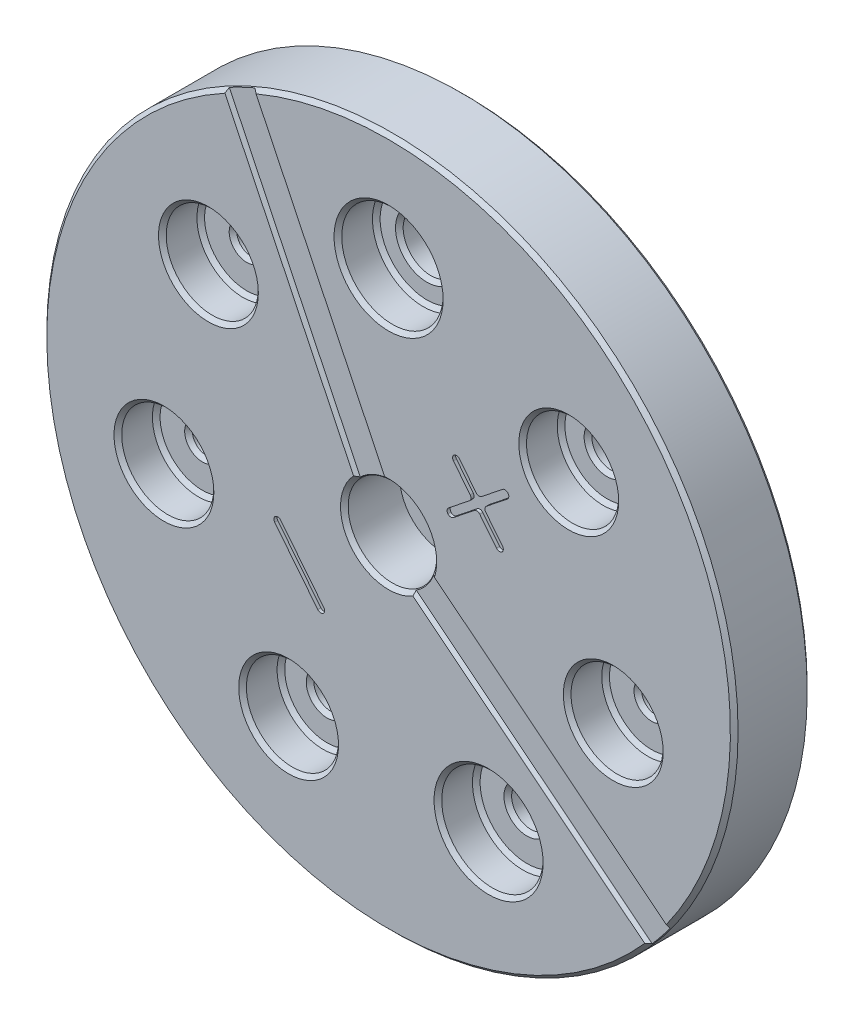
from build123d import *

# Parameters (mm, degrees)
SKETCH1_R               = 28.575
SKETCH1_R_2             = 2.286
SKETCH1_R_3             = 1.5875
SKETCH1_R_4             = 1.143
SKETCH1_R_5             = 1.397
SKETCH1_R_6             = 2.159
BOSS_EXTRUDE1_DEPTH     = 6.35
SKETCH2_R               = 4.191
SKETCH2_R_2             = 3.81
CUT_EXTRUDE1_DEPTH      = 3.175
SKETCH3_R               = 3.6576
CUT_EXTRUDE2_DEPTH      = 4.572
CHAMFER1_SIZE           = 0.3175
CUT_EXTRUDE_THIN2_DEPTH = 0.254
FILLET1_R               = 0.3175
CUT_EXTRUDE_THIN1_DEPTH = 0.254
CHAMFER2_SIZE           = 0.635


# Some blends are built 0.0001 mm under size
with BuildPart() as part:
    # Sketch1 → Boss-Extrude1 (new body)
    with BuildSketch(Plane.XY):
        Circle(SKETCH1_R)
        with Locations((0, 19.05)):
            Circle(SKETCH1_R_2, mode=Mode.SUBTRACT)
        with Locations((14.893889741, 11.877480725)):
            Circle(SKETCH1_R_3, mode=Mode.SUBTRACT)
        with Locations((18.572376727, -4.239023792)):
            Circle(SKETCH1_R_4, mode=Mode.SUBTRACT)
        with Locations((8.26548523, -17.163456934)):
            Circle(SKETCH1_R_3, mode=Mode.SUBTRACT)
        with Locations((-8.26548523, -17.163456934)):
            Circle(SKETCH1_R_5, mode=Mode.SUBTRACT)
        with Locations((-18.572376727, -4.239023792)):
            Circle(SKETCH1_R_4, mode=Mode.SUBTRACT)
        with Locations((-14.893889741, 11.877480725)):
            Circle(SKETCH1_R_4, mode=Mode.SUBTRACT)
        Circle(SKETCH1_R_6, mode=Mode.SUBTRACT)
    extrude(amount=BOSS_EXTRUDE1_DEPTH)

    # Sketch2 → Cut-Extrude1 (cut)
    with BuildSketch(Plane.XY.offset(6.35)):
        with Locations((0, 19.05)):
            Circle(SKETCH2_R)
        with Locations((14.893889741, 11.877480725)):
            Circle(SKETCH2_R_2)
        with Locations((18.572376727, -4.239023792)):
            Circle(SKETCH2_R_2)
        with Locations((8.26548523, -17.163456934)):
            Circle(SKETCH2_R)
        with Locations((-8.26548523, -17.163456934)):
            Circle(SKETCH2_R_2)
        with Locations((-18.572376727, -4.239023792)):
            Circle(SKETCH2_R_2)
        with Locations((-14.893889741, 11.877480725)):
            Circle(SKETCH2_R_2)
    extrude(amount=-CUT_EXTRUDE1_DEPTH, mode=Mode.SUBTRACT)

    # Sketch3 → Cut-Extrude2 (cut)
    with BuildSketch(Plane.XY.offset(6.35)):
        Circle(SKETCH3_R)
    extrude(amount=-CUT_EXTRUDE2_DEPTH, mode=Mode.SUBTRACT)

    # Chamfer1
    chamfer1_edges = [part.edges().sort_by_distance(p)[0] for p in [
        (17.429376727, -4.239023792, 0),
        (6.67798523, -17.163456934, 0),
        (-28.575, 0, 0),
        (-9.66248523, -17.163456934, 0),
        (-19.715376727, -4.239023792, 0),
        (-16.036889741, 11.877480725, 0),
        (-2.159, 0, 0),
        (-28.575, 0, 6.35),
        (11.083889741, 11.877480725, 3.175),
        (13.306389741, 11.877480725, 3.175),
        (11.083889741, 11.877480725, 6.35),
        (13.306389741, 11.877480725, 0),
        (14.762376727, -4.239023792, 3.175),
        (17.429376727, -4.239023792, 3.175),
        (14.762376727, -4.239023792, 6.35),
        (4.07448523, -17.163456934, 3.175),
        (6.67798523, -17.163456934, 3.175),
        (4.07448523, -17.163456934, 6.35),
        (-12.07548523, -17.163456934, 3.175),
        (-9.66248523, -17.163456934, 3.175),
        (-12.07548523, -17.163456934, 6.35),
        (-22.382376727, -4.239023792, 3.175),
        (-19.715376727, -4.239023792, 3.175),
        (-22.382376727, -4.239023792, 6.35),
        (-18.703889741, 11.877480725, 3.175),
        (-16.036889741, 11.877480725, 3.175),
        (-18.703889741, 11.877480725, 6.35),
        (-4.191, 19.05, 3.175),
        (-2.286, 19.05, 3.175),
        (-4.191, 19.05, 6.35),
        (-2.159, 0, 1.778),
        (-3.6576, 0, 6.35),
        (-2.286, 19.05, 0),
    ]]
    chamfer(chamfer1_edges, length=CHAMFER1_SIZE)

    # Sketch5 → Cut-Extrude-Thin2 (cut)
    with BuildSketch(Plane.XY.offset(6.35)):
        Polygon((5.103012367, 3.663418823), (10.06764228, 7.622579065), (9.671726256, 8.119042056), (4.707096343, 4.159881815), align=None)
        Polygon((9.615180928, 3.606873495), (5.656020686, 8.571503409), (5.159557695, 8.175587385), (9.118717937, 3.210957471), align=None)
        Polygon((-9.615180928, -3.606873495), (-5.656020686, -8.571503409), (-5.159557695, -8.175587385), (-9.118717937, -3.210957471), align=None)
    extrude(amount=-CUT_EXTRUDE_THIN2_DEPTH, mode=Mode.SUBTRACT)

    # Fillet1
    fillet1_edges = [part.edges().sort_by_distance(p)[0] for p in [
        (-5.656020686, -8.571503409, 6.223),
        (-9.615180928, -3.606873495, 6.223),
        (-9.118717937, -3.210957471, 6.223),
        (-5.159557695, -8.175587385, 6.223),
        (10.06764228, 7.622579065, 6.223),
        (9.615180928, 3.606873495, 6.223),
        (9.118717937, 3.210957471, 6.223),
        (5.103012367, 3.663418823, 6.223),
        (4.707096343, 4.159881815, 6.223),
        (5.159557695, 8.175587385, 6.223),
        (9.671726256, 8.119042056, 6.223),
        (5.656020686, 8.571503409, 6.223),
        (7.337095828, 5.445040932, 6.223),
        (7.833558819, 5.840956956, 6.223),
        (7.437642795, 6.337419948, 6.223),
        (6.941179804, 5.941503923, 6.223),
    ]]
    fillet(fillet1_edges, radius=FILLET1_R - 0.0001)  # a hair under: the kernel refuses the full size

    # Sketch4 → Cut-Extrude-Thin1 (cut)
    with BuildSketch(Plane.XY.offset(6.35)):
        Polygon((-13.113371884, 25.400790182), (-0.636538078, -0.507622178), (21.845939581, -18.436799827), (22.835729642, -17.195642349), (0.636538078, 0.507622178), (-11.683083806, 26.089580618), align=None)
    extrude(amount=-CUT_EXTRUDE_THIN1_DEPTH, mode=Mode.SUBTRACT)

    # Chamfer2
    # the kernel refuses this chamfer: 0.635 mm, written as the material it takes off along each edge
    with BuildSketch(Plane(origin=(1.273628889, -2.030929502, 6.35), x_dir=(-0.6232540709086805, -0.7815358852062859, 0.027495876610585914), z_dir=(0.7818314824680229, -0.6234898018587423, 0))) as chamfer2_piece_1_section:
        Polygon((CHAMFER2_SIZE * 0.999621916911, CHAMFER2_SIZE * 0.0274958766106), (-CHAMFER2_SIZE * 0.0274958766106, CHAMFER2_SIZE * 0.999621916911), (0, 0), align=None)
    chamfer2_piece_1 = extrude(amount=27.617341328, mode=Mode.PRIVATE)
    chamfer2_piece_1 = split(chamfer2_piece_1, bisect_by=Plane(origin=(11.905816468, -10.845976149, 6.096), z_dir=(0, 0, 1)), keep=Keep.TOP, mode=Mode.PRIVATE)
    add(chamfer2_piece_1, mode=Mode.SUBTRACT)
    with BuildSketch(Plane(origin=(23.855525862, -18.008902696, 6.35), x_dir=(0.6232540709086805, 0.7815358852062859, 0.027495876610585834), z_dir=(-0.7818314824680228, 0.6234898018587423, 0))) as chamfer2_piece_2_section:
        Polygon((CHAMFER2_SIZE * 0.999621916911, CHAMFER2_SIZE * 0.0274958766106), (-CHAMFER2_SIZE * 0.0274958766106, CHAMFER2_SIZE * 0.999621916911), (0, 0), align=None)
    chamfer2_piece_2 = extrude(amount=27.617341328, mode=Mode.PRIVATE)
    chamfer2_piece_2 = split(chamfer2_piece_2, bisect_by=Plane(origin=(13.223338283, -9.193856049, 6.096), z_dir=(0, 0, 1)), keep=Keep.TOP, mode=Mode.PRIVATE)
    add(chamfer2_piece_2, mode=Mode.SUBTRACT)
    with BuildSketch(Plane(origin=(-0.266312692, 2.382411119, 6.35), x_dir=(0.9006282268100128, 0.4337196950133434, 0.02749587661058592), z_dir=(-0.43388373911756706, 0.9009688679024148, 0))) as chamfer2_piece_3_section:
        Polygon((CHAMFER2_SIZE * 0.999621916911, CHAMFER2_SIZE * 0.0274958766106), (-CHAMFER2_SIZE * 0.0274958766106, CHAMFER2_SIZE * 0.999621916911), (0, 0), align=None)
    chamfer2_piece_3 = extrude(amount=27.617341328, mode=Mode.PRIVATE)
    chamfer2_piece_3 = split(chamfer2_piece_3, bisect_by=Plane(origin=(-6.020877298, 14.937627019, 6.096), z_dir=(0, 0, 1)), keep=Keep.TOP, mode=Mode.PRIVATE)
    add(chamfer2_piece_3, mode=Mode.SUBTRACT)
    with BuildSketch(Plane(origin=(-13.679316089, 26.575985434, 6.35), x_dir=(0.024772928821820563, 0.01193001375411458, -0.999621916911297), z_dir=(0.43388373911756706, -0.9009688679024149, 0))) as chamfer2_piece_4_section:
        Polygon((CHAMFER2_SIZE * 0.999621916911, -CHAMFER2_SIZE * 0.0274958766106), (-CHAMFER2_SIZE * 0.0274958766106, -CHAMFER2_SIZE * 0.999621916911), (0, 0), align=None)
    chamfer2_piece_4 = extrude(amount=27.617341328, mode=Mode.PRIVATE)
    chamfer2_piece_4 = split(chamfer2_piece_4, bisect_by=Plane(origin=(-7.924751483, 14.020769534, 6.096), z_dir=(0, 0, 1)), keep=Keep.TOP, mode=Mode.PRIVATE)
    add(chamfer2_piece_4, mode=Mode.SUBTRACT)


solid = part.part
